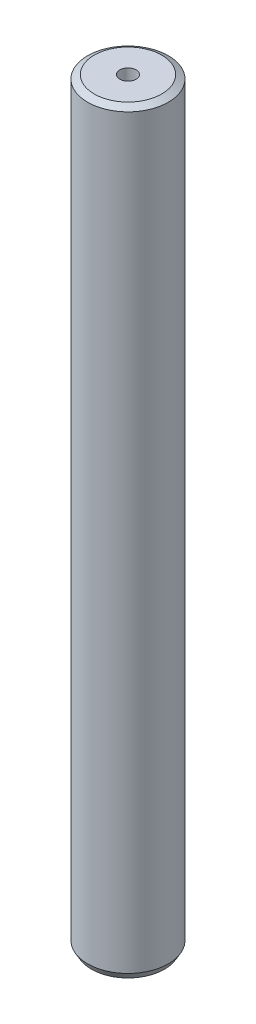
from build123d import *
from OCP.BRepFilletAPI import BRepFilletAPI_MakeChamfer

# Parameters (mm, degrees)
SKETCH1_R           = 5
BOSS_EXTRUDE1_DEPTH = 93.744857003
SKETCH2_R           = 1.008315056
CUT_EXTRUDE1_DEPTH  = 95.011160053
CHAMFER1_SIZE       = 0.47330294
CHAMFER1_SIZE2      = 0.819784739


with BuildPart() as part:
    # Sketch1 → Boss-Extrude1 (new body)
    with BuildSketch(Plane(origin=(0, 0, 0), x_dir=(1, 0, 0), z_dir=(0, 1, 0))):
        Circle(SKETCH1_R)
    extrude(amount=BOSS_EXTRUDE1_DEPTH)

    # Sketch2 → Cut-Extrude1 (cut, through all)
    with BuildSketch(Plane(origin=(0, 0, 0), x_dir=(1, 0, 0), z_dir=(0, 1, 0))):
        Circle(SKETCH2_R)
    extrude(amount=CUT_EXTRUDE1_DEPTH, mode=Mode.SUBTRACT)

    # Chamfer1: one chamfer whose edges measure the first distance from different faces: ONE call of the kernel's chamfer builder (chamfer() names one face for all edges)
    chamfer1_edges_1 = [part.edges().sort_by_distance(p)[0] for p in [
        (-5, 93.744857003, 0),
    ]]
    chamfer1_side_1 = [part.faces().sort_by_distance(p)[0] for p in [
        (-5, 46.872428501, 0),
    ]]
    chamfer1_edges_2 = [part.edges().sort_by_distance(p)[0] for p in [
        (-5, 0, 0),
    ]]
    chamfer1_side_2 = [part.faces().sort_by_distance(p)[0] for p in [
        (-4.858578644, 0, 0),
    ]]
    chamfer1 = BRepFilletAPI_MakeChamfer(part.part.solid().wrapped)
    for e in chamfer1_edges_1:
        chamfer1.Add(CHAMFER1_SIZE, CHAMFER1_SIZE2, e.wrapped, chamfer1_side_1[0].wrapped)  # the first distance lies on this face
    for e in chamfer1_edges_2:
        chamfer1.Add(CHAMFER1_SIZE, CHAMFER1_SIZE2, e.wrapped, chamfer1_side_2[0].wrapped)  # the first distance lies on this face
    add(Compound.cast(chamfer1.Shape()), mode=Mode.REPLACE)


solid = part.part
